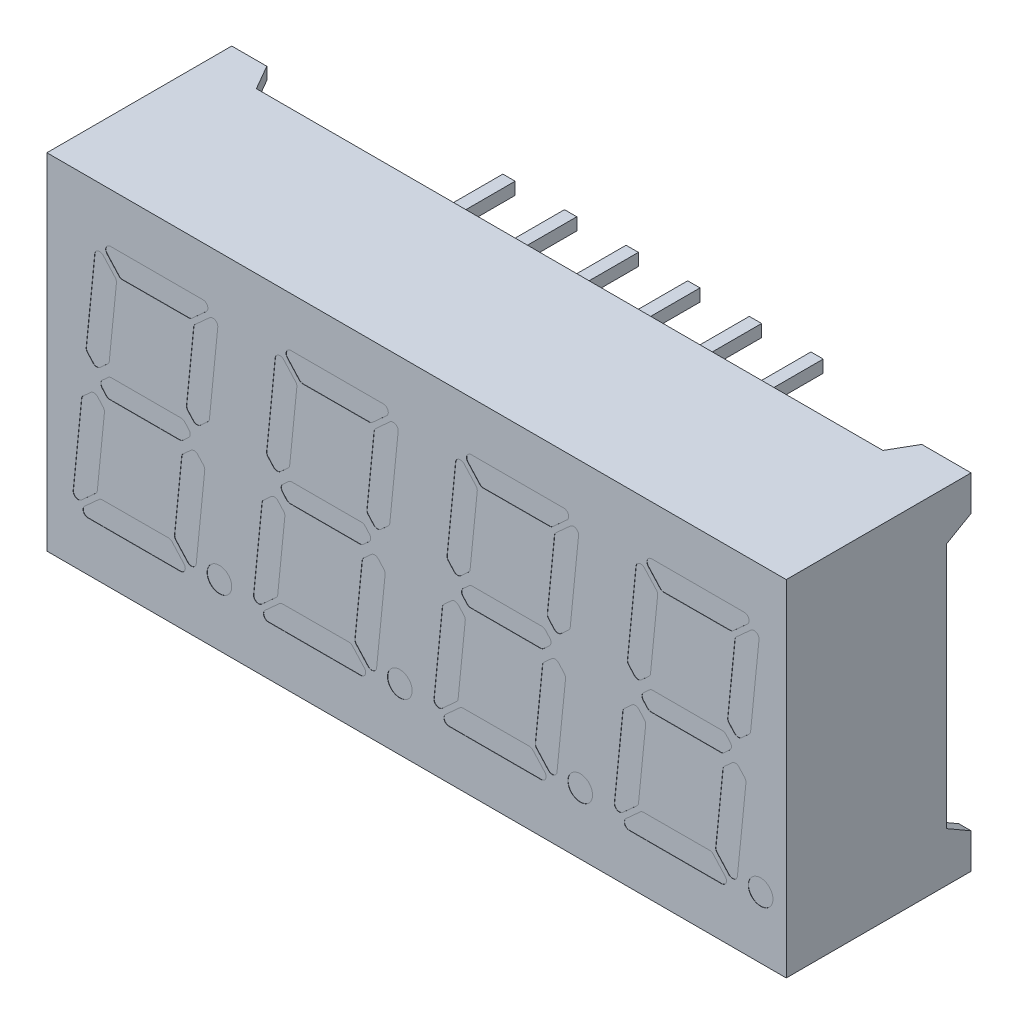
from build123d import *
from OCP.BRepFilletAPI import BRepFilletAPI_MakeChamfer

# Parameters (mm, degrees)
SKETCH_1_W                     = 30
SKETCH_1_H                     = 14
EXTRUDE_1_DEPTH                = 7.5
SKETCH_2_W                     = 9.140066377
SKETCH_2_H                     = 10
SKETCH_2_W_2                   = 2
SKETCH_2_W_3                   = 26
SKETCH_2_H_2                   = 2
SKETCH_2_H_3                   = 4.525361412
CUT_EXTRUDE_1_DEPTH            = 1
SHELL_START                    = -14.5
SHELL_1_OUTLINE_W              = 1.5
SHELL_1_OUTLINE_H              = 7
SHELL_1_DEPTH                  = 1.5
SHELL_START_2                  = 13
SHELL_1_2_OUTLINE_W            = 1.5
SHELL_1_2_OUTLINE_H            = 7
SHELL_1_2_DEPTH                = 1.5
SKETCH_3_W                     = 1.5
SKETCH_3_H                     = 1.5
EXTRUDE_2_DEPTH                = 6
CHAMFER_1_SIZE                 = 1
CHAMFER_1_SIZE_2               = 0.577350269
CHAMFER_2_SIZE                 = 1
CHAMFER_2_SIZE_2               = 0.577350269
CUT_EXTRUDE_2_DEPTH            = 1
SKETCH_4_W                     = 0.5
SKETCH_4_H                     = 0.5
EXTRUDE_3_DEPTH                = 4.5
SKETCH_6_R                     = 0.5
CUT_EXTRUDE_3_DEPTH            = 0.01
FILLET_1_R                     = 0.2
PATTERN_LINEAR_1_COUNT         = 4
PATTERN_LINEAR_1_PITCH         = 7.32
FILLET_1_OF_PATTERN_LINEAR_1_R = 0.2


# Read off the part's stored shape, not the designer's step: Оболочка1
with BuildPart() as part:
    # Эскиз1 → Бобышка-Вытянуть1 (new body)
    with BuildSketch(Plane.XY):
        Rectangle(SKETCH_1_W, SKETCH_1_H)
    extrude(amount=EXTRUDE_1_DEPTH)

    # Эскиз2 → Вырез-Вытянуть1 (cut)
    with BuildSketch(Plane(origin=(0, 0, 0), x_dir=(-1, 0, 0), z_dir=(0, 0, -1))):
        with Locations((-19.570033189, 0)):
            Rectangle(SKETCH_2_W, SKETCH_2_H)
        with Locations((-14, 0)):
            Rectangle(SKETCH_2_W_2, SKETCH_2_H)
        Rectangle(SKETCH_2_W_3, SKETCH_2_H)
        with Locations((0, 6)):
            Rectangle(SKETCH_2_W_3, SKETCH_2_H_2)
        with Locations((0, -6)):
            Rectangle(SKETCH_2_W_3, SKETCH_2_H_2)
        with Locations((14, 0)):
            Rectangle(SKETCH_2_W_2, SKETCH_2_H)
        with Locations((19.570033189, 0)):
            Rectangle(SKETCH_2_W, SKETCH_2_H)
        with Locations((0, 9.262680706)):
            Rectangle(SKETCH_2_W_3, SKETCH_2_H_3)
        with Locations((0, -9.262680706)):
            Rectangle(SKETCH_2_W_3, SKETCH_2_H_3)
    extrude(amount=-CUT_EXTRUDE_1_DEPTH, mode=Mode.SUBTRACT)

    # Оболочка1 outline → Оболочка1 (cut)
    with BuildSketch(Plane.YZ.offset(SHELL_START)):
        with Locations((-5.75, 3.5)):
            Rectangle(SHELL_1_OUTLINE_W, SHELL_1_OUTLINE_H)
        with Locations((5.75, 3.5)):
            Rectangle(SHELL_1_OUTLINE_W, SHELL_1_OUTLINE_H)
    extrude(amount=SHELL_1_DEPTH, mode=Mode.SUBTRACT)

    # Shell 1 2 outline → Shell 1 2 (cut)
    with BuildSketch(Plane.YZ.offset(SHELL_START_2)):
        with Locations((-5.75, 3.5)):
            Rectangle(SHELL_1_2_OUTLINE_W, SHELL_1_2_OUTLINE_H)
        with Locations((5.75, 3.5)):
            Rectangle(SHELL_1_2_OUTLINE_W, SHELL_1_2_OUTLINE_H)
    extrude(amount=SHELL_1_2_DEPTH, mode=Mode.SUBTRACT)

    # Эскиз3 → Бобышка-Вытянуть2 (add)
    with BuildSketch(Plane(origin=(0, 0, 7), x_dir=(-1, 0, 0), z_dir=(0, 0, -1))):
        with Locations((-13.75, -5.75)):
            Rectangle(SKETCH_3_W, SKETCH_3_H)
        with Locations((-13.75, 5.75)):
            Rectangle(SKETCH_3_W, SKETCH_3_H)
        with Locations((13.75, 5.75)):
            Rectangle(SKETCH_3_W, SKETCH_3_H)
        with Locations((13.75, -5.75)):
            Rectangle(SKETCH_3_W, SKETCH_3_H)
    extrude(amount=EXTRUDE_2_DEPTH)

    # Фаска1
    chamfer_1_edges_1 = [part.edges().sort_by_distance(p)[0] for p in [
        (-13, 6.75, 0),
    ]]
    chamfer_1_side_1 = [part.faces().sort_by_distance(p)[0] for p in [
        (-13, 6.75, 0.011547005),
    ]]
    chamfer_1_edges_2 = [part.edges().sort_by_distance(p)[0] for p in [
        (-14.75, -5, 0),
    ]]
    chamfer_1_side_2 = [part.faces().sort_by_distance(p)[0] for p in [
        (-14.75, -5.011547005, 0),
    ]]
    chamfer_1_edges_3 = [part.edges().sort_by_distance(p)[0] for p in [
        (13, -6.75, 0),
    ]]
    chamfer_1_side_3 = [part.faces().sort_by_distance(p)[0] for p in [
        (13.011547005, -6.75, 0),
    ]]
    chamfer_1_edges_4 = [part.edges().sort_by_distance(p)[0] for p in [
        (14.75, 5, 0),
    ]]
    chamfer_1_side_4 = [part.faces().sort_by_distance(p)[0] for p in [
        (14.75, 5, 0.011547005),
    ]]
    chamfer_1_edges_5 = [part.edges().sort_by_distance(p)[0] for p in [
        (13, 6.75, 1),
    ]]
    chamfer_1_side_5 = [part.faces().sort_by_distance(p)[0] for p in [
        (12.988452995, 6.75, 1),
    ]]
    chamfer_1 = BRepFilletAPI_MakeChamfer(part.part.solid().wrapped)
    for e in chamfer_1_edges_1:
        chamfer_1.Add(CHAMFER_1_SIZE - 0.0001, CHAMFER_1_SIZE_2 - 0.0001, e.wrapped, chamfer_1_side_1[0].wrapped)
    for e in chamfer_1_edges_2:
        chamfer_1.Add(CHAMFER_1_SIZE_2 - 0.0001, CHAMFER_1_SIZE - 0.0001, e.wrapped, chamfer_1_side_2[0].wrapped)
    for e in chamfer_1_edges_3:
        chamfer_1.Add(CHAMFER_1_SIZE_2 - 0.0001, CHAMFER_1_SIZE - 0.0001, e.wrapped, chamfer_1_side_3[0].wrapped)
    for e in chamfer_1_edges_4:
        chamfer_1.Add(CHAMFER_1_SIZE - 0.0001, CHAMFER_1_SIZE_2 - 0.0001, e.wrapped, chamfer_1_side_4[0].wrapped)
    for e in chamfer_1_edges_5:
        chamfer_1.Add(CHAMFER_1_SIZE_2 - 0.0001, CHAMFER_1_SIZE - 0.0001, e.wrapped, chamfer_1_side_5[0].wrapped)
    add(Compound.cast(chamfer_1.Shape()), mode=Mode.REPLACE)  # a hair under: the kernel refuses the full size

    # Фаска2
    chamfer_2_edges_1 = [part.edges().sort_by_distance(p)[0] for p in [
        (14.75, -5, 0),
    ]]
    chamfer_2_side_1 = [part.faces().sort_by_distance(p)[0] for p in [
        (14.75, -5, 0.011547005),
    ]]
    chamfer_2_edges_2 = [part.edges().sort_by_distance(p)[0] for p in [
        (-13, -6.75, 0),
    ]]
    chamfer_2_side_2 = [part.faces().sort_by_distance(p)[0] for p in [
        (-13.011547005, -6.75, 0),
    ]]
    chamfer_2_edges_3 = [part.edges().sort_by_distance(p)[0] for p in [
        (-14.75, 5, 0),
    ]]
    chamfer_2_side_3 = [part.faces().sort_by_distance(p)[0] for p in [
        (-14.75, 5.011547005, 0),
    ]]
    chamfer_2 = BRepFilletAPI_MakeChamfer(part.part.solid().wrapped)
    for e in chamfer_2_edges_1:
        chamfer_2.Add(CHAMFER_2_SIZE - 0.0001, CHAMFER_2_SIZE_2 - 0.0001, e.wrapped, chamfer_2_side_1[0].wrapped)
    for e in chamfer_2_edges_2:
        chamfer_2.Add(CHAMFER_2_SIZE_2 - 0.0001, CHAMFER_2_SIZE - 0.0001, e.wrapped, chamfer_2_side_2[0].wrapped)
    for e in chamfer_2_edges_3:
        chamfer_2.Add(CHAMFER_2_SIZE_2 - 0.0001, CHAMFER_2_SIZE - 0.0001, e.wrapped, chamfer_2_side_3[0].wrapped)
    add(Compound.cast(chamfer_2.Shape()), mode=Mode.REPLACE)  # a hair under: the kernel refuses the full size

    # Эскиз5 → Вырез-Вытянуть2 (cut)
    with BuildSketch(Plane(origin=(0, 0, 1), x_dir=(-1, 0, 0), z_dir=(0, 0, -1))):
        Polygon((-14.5, -5), (-14.5, 5), (-14.5, 6.5), (-12.422649731, 6.5), (13, 6.5), (14.5, 6.5), (14.5, 5), (14.5, -5), (14.5, -6.5), (13, -6.5), (-13, -6.5), (-14.5, -6.5), align=None)
    extrude(amount=-CUT_EXTRUDE_2_DEPTH, mode=Mode.SUBTRACT)

    # Эскиз4 → Бобышка-Вытянуть3 (add)
    with BuildSketch(Plane(origin=(0, 0, 2), x_dir=(-1, 0, 0), z_dir=(0, 0, -1))):
        with Locations((-6.25, -5.25)):
            Rectangle(SKETCH_4_W, SKETCH_4_H)
        with Locations((-3.75, -5.25)):
            Rectangle(SKETCH_4_W, SKETCH_4_H)
        with Locations((-1.25, -5.25)):
            Rectangle(SKETCH_4_W, SKETCH_4_H)
        with Locations((1.25, -5.25)):
            Rectangle(SKETCH_4_W, SKETCH_4_H)
        with Locations((3.75, -5.25)):
            Rectangle(SKETCH_4_W, SKETCH_4_H)
        with Locations((6.25, -5.25)):
            Rectangle(SKETCH_4_W, SKETCH_4_H)
        with Locations((3.75, 5.25)):
            Rectangle(SKETCH_4_W, SKETCH_4_H)
        with Locations((1.25, 5.25)):
            Rectangle(SKETCH_4_W, SKETCH_4_H)
        with Locations((-1.25, 5.25)):
            Rectangle(SKETCH_4_W, SKETCH_4_H)
        with Locations((-3.75, 5.25)):
            Rectangle(SKETCH_4_W, SKETCH_4_H)
        with Locations((-6.25, 5.25)):
            Rectangle(SKETCH_4_W, SKETCH_4_H)
        with Locations((6.25, 5.25)):
            Rectangle(SKETCH_4_W, SKETCH_4_H)
    extrude(amount=EXTRUDE_3_DEPTH)

    # Эскиз6 → Вырез-Вытянуть3 (cut)
    with BuildSketch(Plane.XY.offset(7.5)):
        Polygon((-11.995012438, 5), (-12.081592331, 4.134201064), (-12.020867185, 4.067100532), (-9.172088094, 4.074145253), (-9.090158511, 4.148290507), (-9.004987562, 5), align=None)
        Polygon((-12.8651296, 5), (-12.081592331, 4.134201064), (-11.995012438, 5), align=None)
        Polygon((-9.004987562, 5), (-9.090158511, 4.148290507), (-8.149030115, 5), align=None)
        Polygon((-8.955957447, 4), (-8.1, 4), (-8.014829051, 4.851709493), align=None)
        Polygon((-9.344179767, 0.862927373), (-8.925236252, 0.4), (-8.413707263, 0.862927373), (-8.1, 4), (-8.955957447, 4), (-9.03788703, 3.925854747), align=None)
        Polygon((-12.455012438, 0.4), (-12.535012438, -0.4), (-9.544987562, -0.4), (-9.464987562, 0.4), align=None)
        Polygon((-9.464987562, 0.4), (-9.544987562, -0.4), (-9.102992537, 0), align=None)
        Polygon((-12.897007463, 0), (-12.535012438, -0.4), (-12.455012438, 0.4), align=None)
        Polygon((-13.413355027, 0.866449734), (-12.991223819, 0.4), (-12.475802665, 0.866449734), (-12.169157691, 3.932899468), (-12.229882838, 4), (-13.1, 4), align=None)
        Polygon((-13.013420106, 4.865798936), (-13.1, 4), (-12.229882838, 4), align=None)
        Polygon((-13.9, -4), (-13.044042553, -4), (-12.96211297, -3.925854747), (-12.655820233, -0.862927373), (-13.074763748, -0.4), (-13.586292737, -0.862927373), align=None)
        Polygon((-13.9, -4), (-13.985170949, -4.851709493), (-13.044042553, -4), align=None)
        Polygon((-13.850969885, -5), (-12.995012438, -5), (-12.909841489, -4.148290507), align=None)
        Polygon((-12.909841489, -4.148290507), (-12.995012438, -5), (-10.004987562, -5), (-9.918407669, -4.134201064), (-9.979132815, -4.067100532), (-12.827911906, -4.074145253), align=None)
        Polygon((-9.918407669, -4.134201064), (-10.004987562, -5), (-9.1348704, -5), align=None)
        Polygon((-9.770117162, -4), (-8.986579894, -4.865798936), (-8.9, -4), align=None)
        Polygon((-9.830842309, -3.932899468), (-9.770117162, -4), (-8.9, -4), (-8.586644973, -0.866449734), (-9.008776181, -0.4), (-9.524197335, -0.866449734), align=None)
        with Locations((-8, -4.5)):
            Circle(SKETCH_6_R)
    cut_extrude_3 = extrude(amount=-CUT_EXTRUDE_3_DEPTH, mode=Mode.SUBTRACT)

    # Скругление1
    fillet_1_edges = [part.edges().sort_by_distance(p)[0] for p in [
        (-13.074763748, -0.4, 7.495),
        (-12.655820233, -0.862927373, 7.495),
        (-12.96211297, -3.925854747, 7.495),
        (-13.985170949, -4.851709493, 7.495),
        (-13.586292737, -0.862927373, 7.495),
        (-12.991223819, 0.4, 7.495),
        (-13.413355027, 0.866449734, 7.495),
        (-13.013420106, 4.865798936, 7.495),
        (-12.169157691, 3.932899468, 7.495),
        (-12.475802665, 0.866449734, 7.495),
        (-8.014829051, 4.851709493, 7.495),
        (-8.413707263, 0.862927373, 7.495),
        (-8.925236252, 0.4, 7.495),
        (-9.344179767, 0.862927373, 7.495),
        (-9.03788703, 3.925854747, 7.495),
        (-12.455012438, 0.4, 7.495),
        (-9.464987562, 0.4, 7.495),
        (-9.102992537, 0, 7.495),
        (-9.544987562, -0.4, 7.495),
        (-12.535012438, -0.4, 7.495),
        (-12.897007463, 0, 7.495),
        (-8.986579894, -4.865798936, 7.495),
        (-9.830842309, -3.932899468, 7.495),
        (-9.524197335, -0.866449734, 7.495),
        (-9.008776181, -0.4, 7.495),
        (-8.586644973, -0.866449734, 7.495),
        (-13.850969885, -5, 7.495),
        (-12.827911906, -4.074145253, 7.495),
        (-9.979132815, -4.067100532, 7.495),
        (-9.1348704, -5, 7.495),
        (-12.020867185, 4.067100532, 7.495),
        (-12.8651296, 5, 7.495),
        (-8.149030115, 5, 7.495),
        (-9.172088094, 4.074145253, 7.495),
    ]]
    fillet(fillet_1_edges, radius=FILLET_1_R)

    # Линейный массив1: Вырез-Вытянуть3 ×4
    with Locations(*[(i * PATTERN_LINEAR_1_PITCH, 0, 0) for i in range(1, PATTERN_LINEAR_1_COUNT)]):
        add(cut_extrude_3, mode=Mode.SUBTRACT)

    # Скругление1 of Линейный массив1
    fillet_1_of_pattern_linear_1_edges = [part.edges().sort_by_distance(p)[0] for p in [
        (-5.754763748, -0.4, 7.495),
        (-5.335820233, -0.862927373, 7.495),
        (-5.64211297, -3.925854747, 7.495),
        (-6.665170949, -4.851709493, 7.495),
        (-6.266292737, -0.862927373, 7.495),
        (-5.671223819, 0.4, 7.495),
        (-6.093355027, 0.866449734, 7.495),
        (-5.693420106, 4.865798936, 7.495),
        (-4.849157691, 3.932899468, 7.495),
        (-5.155802665, 0.866449734, 7.495),
        (-0.694829051, 4.851709493, 7.495),
        (-1.093707263, 0.862927373, 7.495),
        (-1.605236252, 0.4, 7.495),
        (-2.024179767, 0.862927373, 7.495),
        (-1.71788703, 3.925854747, 7.495),
        (-5.135012438, 0.4, 7.495),
        (-2.144987562, 0.4, 7.495),
        (-1.782992537, 0, 7.495),
        (-2.224987562, -0.4, 7.495),
        (-5.215012438, -0.4, 7.495),
        (-5.577007463, 0, 7.495),
        (-1.666579894, -4.865798936, 7.495),
        (-2.510842309, -3.932899468, 7.495),
        (-2.204197335, -0.866449734, 7.495),
        (-1.688776181, -0.4, 7.495),
        (-1.266644973, -0.866449734, 7.495),
        (-6.530969885, -5, 7.495),
        (-5.507911906, -4.074145253, 7.495),
        (-2.659132815, -4.067100532, 7.495),
        (-1.8148704, -5, 7.495),
        (-4.700867185, 4.067100532, 7.495),
        (-5.5451296, 5, 7.495),
        (-0.829030115, 5, 7.495),
        (-1.852088094, 4.074145253, 7.495),
        (1.565236252, -0.4, 7.495),
        (1.984179767, -0.862927373, 7.495),
        (1.67788703, -3.925854747, 7.495),
        (0.654829051, -4.851709493, 7.495),
        (1.053707263, -0.862927373, 7.495),
        (1.648776181, 0.4, 7.495),
        (1.226644973, 0.866449734, 7.495),
        (1.626579894, 4.865798936, 7.495),
        (2.470842309, 3.932899468, 7.495),
        (2.164197335, 0.866449734, 7.495),
        (6.625170949, 4.851709493, 7.495),
        (6.226292737, 0.862927373, 7.495),
        (5.714763748, 0.4, 7.495),
        (5.295820233, 0.862927373, 7.495),
        (5.60211297, 3.925854747, 7.495),
        (2.184987562, 0.4, 7.495),
        (5.175012438, 0.4, 7.495),
        (5.537007463, 0, 7.495),
        (5.095012438, -0.4, 7.495),
        (2.104987562, -0.4, 7.495),
        (1.742992537, 0, 7.495),
        (5.653420106, -4.865798936, 7.495),
        (4.809157691, -3.932899468, 7.495),
        (5.115802665, -0.866449734, 7.495),
        (5.631223819, -0.4, 7.495),
        (6.053355027, -0.866449734, 7.495),
        (0.789030115, -5, 7.495),
        (1.812088094, -4.074145253, 7.495),
        (4.660867185, -4.067100532, 7.495),
        (5.5051296, -5, 7.495),
        (2.619132815, 4.067100532, 7.495),
        (1.7748704, 5, 7.495),
        (6.490969885, 5, 7.495),
        (5.467911906, 4.074145253, 7.495),
        (8.885236252, -0.4, 7.495),
        (9.304179767, -0.862927373, 7.495),
        (8.99788703, -3.925854747, 7.495),
        (7.974829051, -4.851709493, 7.495),
        (8.373707263, -0.862927373, 7.495),
        (8.968776181, 0.4, 7.495),
        (8.546644973, 0.866449734, 7.495),
        (8.946579894, 4.865798936, 7.495),
        (9.790842309, 3.932899468, 7.495),
        (9.484197335, 0.866449734, 7.495),
        (13.945170949, 4.851709493, 7.495),
        (13.546292737, 0.862927373, 7.495),
        (13.034763748, 0.4, 7.495),
        (12.615820233, 0.862927373, 7.495),
        (12.92211297, 3.925854747, 7.495),
        (9.504987562, 0.4, 7.495),
        (12.495012438, 0.4, 7.495),
        (12.857007463, 0, 7.495),
        (12.415012438, -0.4, 7.495),
        (9.424987562, -0.4, 7.495),
        (9.062992537, 0, 7.495),
        (12.973420106, -4.865798936, 7.495),
        (12.129157691, -3.932899468, 7.495),
        (12.435802665, -0.866449734, 7.495),
        (12.951223819, -0.4, 7.495),
        (13.373355027, -0.866449734, 7.495),
        (8.109030115, -5, 7.495),
        (9.132088094, -4.074145253, 7.495),
        (11.980867185, -4.067100532, 7.495),
        (12.8251296, -5, 7.495),
        (9.939132815, 4.067100532, 7.495),
        (9.0948704, 5, 7.495),
        (13.810969885, 5, 7.495),
        (12.787911906, 4.074145253, 7.495),
    ]]
    fillet(fillet_1_of_pattern_linear_1_edges, radius=FILLET_1_OF_PATTERN_LINEAR_1_R)


solid = part.part
